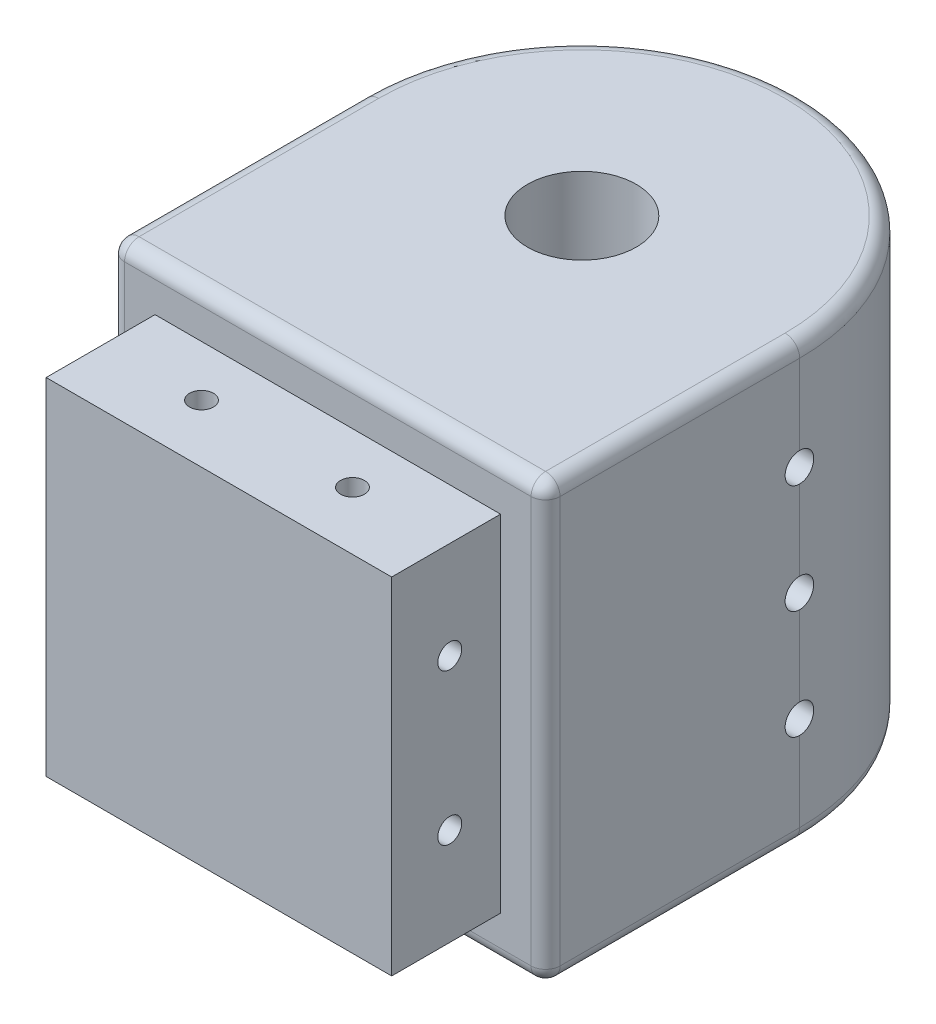
from build123d import *

# Parameters (mm, degrees)
SKETCH2_W                  = 60
SKETCH2_H                  = 60
BOSS_EXTRUDE1_DEPTH        = 80
SKETCH3_OUTSIDE_W          = 85.324
SKETCH3_OUTSIDE_H          = 85.324
SKETCH3_OUTSIDE_W_2        = 47.6
SKETCH3_OUTSIDE_H_2        = 47.6
CUT_EXTRUDE1_DEPTH         = 15
SKETCH4_W                  = 60
SKETCH4_H                  = 5
CUT_EXTRUDE2_DEPTH         = 87
SKETCH5_R                  = 7.5
CUT_EXTRUDE3_DEPTH         = 87
M4_TAPPED_HOLE1_AT_2_COUNT = 2
M4_TAPPED_HOLE1_AT_2_PITCH = 20.8
CIRPATTERN1_COUNT          = 4
FILLET2_R                  = 30
SKETCH19_R                 = 2
CUT_EXTRUDE6_DEPTH         = 105.403065089
BOSS_EXTRUDE3_START        = 5
SKETCH21_R                 = 7.5
BOSS_EXTRUDE3_DEPTH        = 5
FILLET3_R                  = 2


with BuildPart() as part:
    # Sketch2 → Boss-Extrude1 (new body)
    with BuildSketch(Plane.XY):
        Rectangle(SKETCH2_W, SKETCH2_H)
    extrude(amount=BOSS_EXTRUDE1_DEPTH)

    # Sketch3 outside → Cut-Extrude1 (cut)
    with BuildSketch(Plane.XY.offset(80)):
        Rectangle(SKETCH3_OUTSIDE_W, SKETCH3_OUTSIDE_H)
        Rectangle(SKETCH3_OUTSIDE_W_2, SKETCH3_OUTSIDE_H_2, mode=Mode.SUBTRACT)
    extrude(amount=-CUT_EXTRUDE1_DEPTH, mode=Mode.SUBTRACT)

    # Sketch4 → Cut-Extrude2 (cut)
    with BuildSketch(Plane(origin=(30, 0, 0), x_dir=(0, 0, -1), z_dir=(1, 0, 0))):
        with Locations((-30, 27.5)):
            Rectangle(SKETCH4_W, SKETCH4_H)
        with Locations((-30, -27.5)):
            Rectangle(SKETCH4_W, SKETCH4_H)
    extrude(amount=-CUT_EXTRUDE2_DEPTH, mode=Mode.SUBTRACT)

    # Sketch5 → Cut-Extrude3 (cut)
    with BuildSketch(Plane(origin=(0, 25, 0), x_dir=(1, 0, 0), z_dir=(0, 1, 0))):
        with Locations(Location((0, -30, 0), (0, 0, 270))):
            Circle(SKETCH5_R)
    extrude(amount=-CUT_EXTRUDE3_DEPTH, mode=Mode.SUBTRACT)

    # Sketch16 → M4 Tapped Hole1 (revolve, cut)
    with BuildSketch(Plane(origin=(-23.8, 10.4, 72), x_dir=(0, 0, 1), z_dir=(0, 1, 0))):
        Polygon((0, 0), (0, 12.491420021), (1.65, 11.5), (1.65, 0), align=None)
    m4_tapped_hole1 = revolve(axis=Axis((-30.15, 10.4, 72), (1, 0, 0)), mode=Mode.SUBTRACT)

    # M4 Tapped Hole1 at 2: M4 Tapped Hole1 ×2
    with Locations(*[(0, -i * M4_TAPPED_HOLE1_AT_2_PITCH, 0) for i in range(1, M4_TAPPED_HOLE1_AT_2_COUNT)]):
        add(m4_tapped_hole1, mode=Mode.SUBTRACT)

    # CirPattern1: M4 Tapped Hole1 ×4 about axis
    cirpattern1_axis = Axis((0, 0, 0), (0, 0, 1))
    for i in range(1, CIRPATTERN1_COUNT):
        add(m4_tapped_hole1.rotate(cirpattern1_axis, i * 360 / CIRPATTERN1_COUNT), mode=Mode.SUBTRACT)

    # CirPattern1 copy 1 sketch → CirPattern1 copy 1 (revolve, cut)
    with BuildSketch(Plane(origin=(10.4, -23.8, 72), x_dir=(0, 0, 1), z_dir=(-1, 0, 0))):
        Polygon((0, 0), (0, 12.491420021), (1.65, 11.5), (1.65, 0), align=None)
    revolve(axis=Axis((10.4, -30.15, 72), (0, 1, 0)), mode=Mode.SUBTRACT)

    # CirPattern1 copy 2 sketch → CirPattern1 copy 2 (revolve, cut)
    with BuildSketch(Plane(origin=(23.8, 10.4, 72), x_dir=(0, 0, 1), z_dir=(0, -1, 0))):
        Polygon((0, 0), (0, 12.491420021), (1.65, 11.5), (1.65, 0), align=None)
    revolve(axis=Axis((30.15, 10.4, 72), (-1, 0, 0)), mode=Mode.SUBTRACT)

    # CirPattern1 copy 3 sketch → CirPattern1 copy 3 (revolve, cut)
    with BuildSketch(Plane(origin=(-10.4, 23.8, 72), x_dir=(0, 0, 1), z_dir=(1, 0, 0))):
        Polygon((0, 0), (0, 12.491420021), (1.65, 11.5), (1.65, 0), align=None)
    revolve(axis=Axis((-10.4, 30.15, 72), (0, -1, 0)), mode=Mode.SUBTRACT)

    # Fillet2
    fillet2_edges = [part.edges().sort_by_distance(p)[0] for p in [
        (30, 0, 0),
        (-30, 0, 0),
    ]]
    fillet(fillet2_edges, radius=FILLET2_R - 0.0001)  # a hair under: the kernel refuses the full size

    # Sketch19 → Cut-Extrude6 (cut, through all)
    with BuildSketch(Plane(origin=(30, 0, 0), x_dir=(0, 0, -1), z_dir=(1, 0, 0))):
        with Locations((-30, 0)):
            Circle(SKETCH19_R)
        with Locations((-30, 15)):
            Circle(SKETCH19_R)
        with Locations((-30, -15)):
            Circle(SKETCH19_R)
    extrude(amount=-CUT_EXTRUDE6_DEPTH, mode=Mode.SUBTRACT)

    # Sketch21 → Boss-Extrude3 (add)
    with BuildSketch(Plane(origin=(0, 25, 0), x_dir=(1, 0, 0), z_dir=(0, 1, 0)).offset(BOSS_EXTRUDE3_START)):
        with BuildLine():
            Line((30, -60), (30, -30))
            ThreePointArc((30, -30), (21.213203436, -8.786796564), (0, 0))
            ThreePointArc((0, 0), (-21.213203436, -8.786796564), (-30, -30))
            Line((-30, -30), (-30, -60))
            Line((-30, -60), (30, -60))
        make_face()
        with Locations(Location((0, -30, 0), (0, 0, 270))):
            Circle(SKETCH21_R, mode=Mode.SUBTRACT)
    boss_extrude3 = extrude(amount=-BOSS_EXTRUDE3_DEPTH)

    # Mirror4: Boss-Extrude3 across plane
    add(boss_extrude3.mirror(Plane.ZX))

    # Fillet3
    fillet3_edges = [part.edges().sort_by_distance(p)[0] for p in [
        (30, -30, 47.5),
        (-30, -30, 47.5),
        (0, -30, 65),
        (-30, 30, 47.5),
        (30, 30, 47.5),
        (0, 30, 0),
        (0, -30, 0),
        (30, 0, 65),
        (0, 30, 65),
        (-30, 0, 65),
    ]]
    fillet(fillet3_edges, radius=FILLET3_R)


solid = part.part
